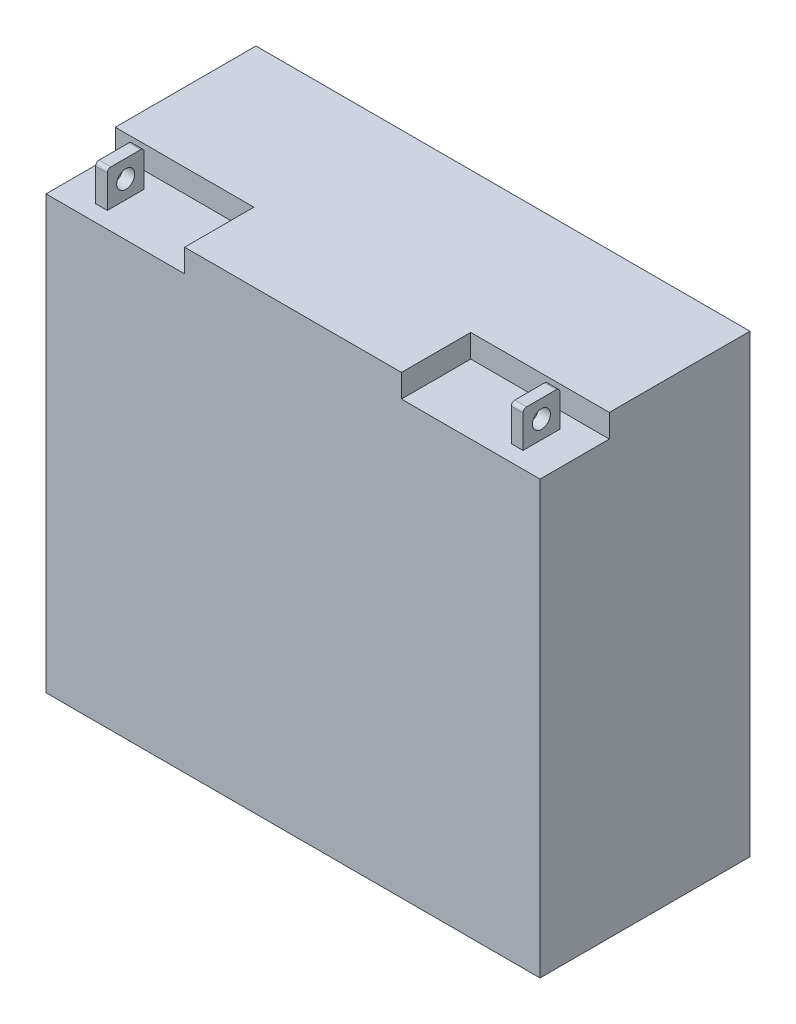
from build123d import *

# Parameters (mm, degrees)
SKETCH2_W           = 181.102
SKETCH2_H           = 76.962
BOSS_EXTRUDE1_DEPTH = 166.878
CUT_EXTRUDE1_DEPTH  = 194.722837699
SKETCH4_3_W         = 50.8
SKETCH4_3_H         = 25.4
CUT_EXTRUDE2_DEPTH  = 8.466666667
SKETCH5_W           = 4.318
SKETCH5_H           = 13.462
BOSS_EXTRUDE2_DEPTH = 13.208
SKETCH6_R           = 3.302
CUT_EXTRUDE3_DEPTH  = 13.208
FILLET1_R           = 1.27


with BuildPart() as part:
    # Sketch2 → Boss-Extrude1 (new body)
    with BuildSketch(Plane(origin=(0, 0, 0), x_dir=(1, 0, 0), z_dir=(0, 1, 0))):
        Rectangle(SKETCH2_W, SKETCH2_H)
    extrude(amount=BOSS_EXTRUDE1_DEPTH)

    # Sketch4 → Cut-Extrude1 (cut, through all)
    with BuildSketch(Plane(origin=(0, 166.878, 0), x_dir=(1, 0, 0), z_dir=(0, 1, 0))):
        Polygon((0, -38.481), (0, 0), (0, 38.481), (-90.551, 38.481), (-90.551, -38.481), align=None)
    extrude(amount=-CUT_EXTRUDE1_DEPTH, mode=Mode.SUBTRACT)

    # Sketch4<3> → Cut-Extrude2 (cut)
    with BuildSketch(Plane(origin=(0, 166.878, 0), x_dir=(1, 0, 0), z_dir=(0, 1, 0))):
        with Locations((65.151, -25.781)):
            Rectangle(SKETCH4_3_W, SKETCH4_3_H)
    extrude(amount=-CUT_EXTRUDE2_DEPTH, mode=Mode.SUBTRACT)

    # Sketch5 → Boss-Extrude2 (add)
    with BuildSketch(Plane(origin=(0, 158.411333333, 0), x_dir=(1, 0, 0), z_dir=(0, 1, 0))):
        with Locations((76.2, -25.781)):
            Rectangle(SKETCH5_W, SKETCH5_H)
    extrude(amount=BOSS_EXTRUDE2_DEPTH)

    # Sketch6 → Cut-Extrude3 (cut)
    with BuildSketch(Plane(origin=(78.359, 0, 0), x_dir=(0, 0, -1), z_dir=(1, 0, 0))):
        with Locations((-25.781, 165.015333333)):
            Circle(SKETCH6_R)
    extrude(amount=-CUT_EXTRUDE3_DEPTH, mode=Mode.SUBTRACT)

    # Fillet1
    fillet1_edges = [part.edges().sort_by_distance(p)[0] for p in [
        (76.2, 171.619333333, 19.05),
        (76.2, 171.619333333, 32.512),
    ]]
    fillet(fillet1_edges, radius=FILLET1_R)

    # Mirror1: part across plane


with BuildPart() as part_1:
    add(part.part)
    add(part.part.mirror(Plane.ZY))


solid = part_1.part
